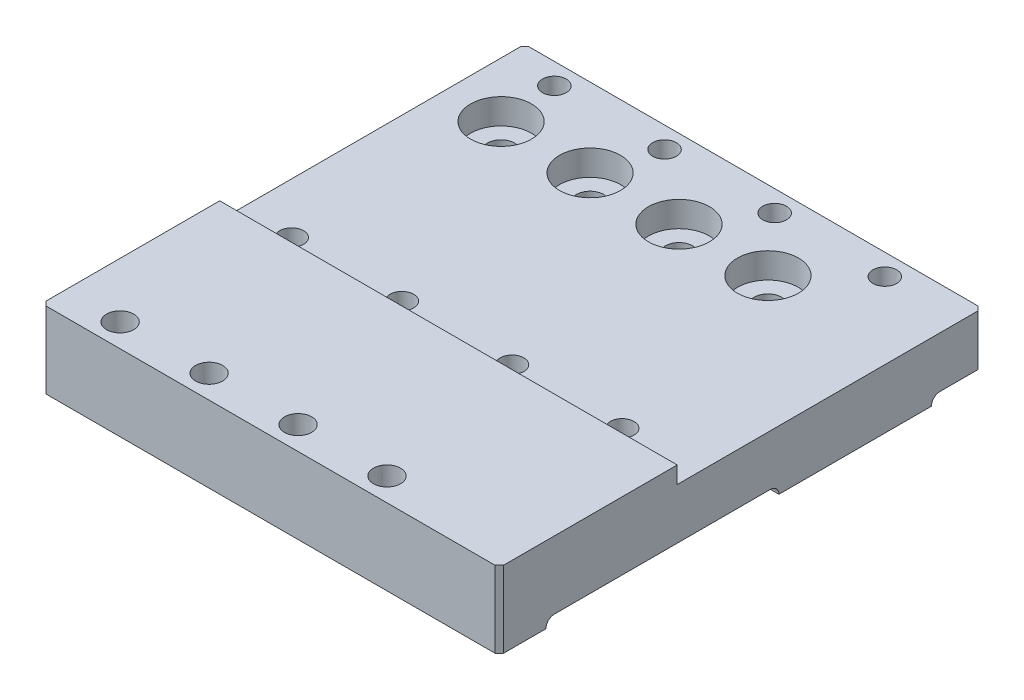
from build123d import *

# Parameters (mm, degrees)
SKETCH_1_W                     = 540
SKETCH_1_H                     = 570
EXTRUDE_1_DEPTH                = 90
CUT_EXTRUDE_1_REACH            = 619.191
SKETCH_2_W                     = 360
SKETCH_2_H                     = 20
SKETCH_2_W_2                   = 60
SKETCH_2_H_2                   = 10
SKETCH_2_W_3                   = 275
M30X2_0_1_D                    = 28
PATTERN_LINEAR_1_COUNT         = 4
PATTERN_LINEAR_1_PITCH         = 130
PATTERN_LINEAR_1_COUNT_DIR2    = 2
PATTERN_LINEAR_1_PITCH_DIR2    = 310
HOLE_WIZARD_M1_6_1_D           = 32
HOLE_WIZARD_M1_6_1_CBORE_D     = 72
HOLE_WIZARD_M1_6_1_CBORE_DEPTH = 30
PATTERN_LINEAR_2_COUNT         = 4
PATTERN_LINEAR_2_PITCH         = 105
HOLE_WIZARD_1_0_1_1_D          = 32
PATTERN_LINEAR_3_COUNT         = 4
PATTERN_LINEAR_3_PITCH         = 105
FILLET_1_R                     = 10
HOLE_WIZARD_M16_1_D            = 14
HOLE_WIZARD_M16_1_DEPTH        = 30
HOLE_WIZARD_M16_1_TIP          = 4.206024333
CHAMFER_1_SIZE                 = 5


with BuildPart() as part:
    # 草图1 → 凸台-拉伸1 (new body)
    with BuildSketch(Plane(origin=(0, 0, 0), x_dir=(1, 0, 0), z_dir=(0, 1, 0))):
        Rectangle(SKETCH_1_W, SKETCH_1_H)
    extrude(amount=-EXTRUDE_1_DEPTH)

    # 草图2 → 切除-拉伸1 (cut, up to next)
    with BuildSketch(Plane.ZY.offset(270), mode=Mode.PRIVATE) as cut_extrude_1_sk1:
        with Locations((-105, -10)):
            Rectangle(SKETCH_2_W, SKETCH_2_H)
    cut_extrude_1_tool1 = extrude(cut_extrude_1_sk1.sketch, amount=-CUT_EXTRUDE_1_REACH, mode=Mode.PRIVATE) & part.part
    # 草图2 → 切除-拉伸1 (cut, up to next)
    with BuildSketch(Plane.ZY.offset(270), mode=Mode.PRIVATE) as cut_extrude_1_sk2:
        with Locations((-255, -85)):
            Rectangle(SKETCH_2_W_2, SKETCH_2_H_2)
    cut_extrude_1_tool2 = extrude(cut_extrude_1_sk2.sketch, amount=-CUT_EXTRUDE_1_REACH, mode=Mode.PRIVATE) & part.part
    # 草图2 → 切除-拉伸1 (cut, up to next)
    with BuildSketch(Plane.ZY.offset(270), mode=Mode.PRIVATE) as cut_extrude_1_sk3:
        with Locations((92.5, -85)):
            Rectangle(SKETCH_2_W_3, SKETCH_2_H_2)
    cut_extrude_1_tool3 = extrude(cut_extrude_1_sk3.sketch, amount=-CUT_EXTRUDE_1_REACH, mode=Mode.PRIVATE) & part.part
    add(cut_extrude_1_tool1.solids().sort_by_distance((-270, -10, -105))[0], mode=Mode.SUBTRACT)
    add(cut_extrude_1_tool2.solids().sort_by_distance((-270, -85, -255))[0], mode=Mode.SUBTRACT)
    add(cut_extrude_1_tool3.solids().sort_by_distance((-270, -85, 92.5))[0], mode=Mode.SUBTRACT)

    # M30x2.0 螺纹孔1 (through all)
    with Locations(Plane(origin=(180, -20, 50), x_dir=(0, 0, 1), z_dir=(0, 1, 0))):
        with Locations((0, 0)):
            m30x2_0_1 = Hole(M30X2_0_1_D / 2)

    # 阵列(线性)1: M30x2.0 _1 4 × 2
    with Locations(*[(-i * PATTERN_LINEAR_1_PITCH, 0, -j * PATTERN_LINEAR_1_PITCH_DIR2) for i in range(PATTERN_LINEAR_1_COUNT) for j in range(PATTERN_LINEAR_1_COUNT_DIR2) if (i, j) != (0, 0)]):
        add(m30x2_0_1, mode=Mode.SUBTRACT)

    # M1.6 六角头螺栓的柱形沉头孔1 (through all)
    with Locations(Plane(origin=(-205, -20, -192.080967971), x_dir=(0, 0, 1), z_dir=(0, 1, 0))):
        with Locations((0, 0)):
            hole_wizard_m1_6_1 = CounterBoreHole(HOLE_WIZARD_M1_6_1_D / 2, HOLE_WIZARD_M1_6_1_CBORE_D / 2, HOLE_WIZARD_M1_6_1_CBORE_DEPTH)

    # 阵列(线性)2: M1.6 六角头螺栓的柱形沉头孔1 ×4
    with Locations(*[(i * PATTERN_LINEAR_2_PITCH, 0, 0) for i in range(1, PATTERN_LINEAR_2_COUNT)]):
        add(hole_wizard_m1_6_1, mode=Mode.SUBTRACT)

    # Ø1.0 (1) 直径孔1 (through all)
    with Locations(Plane(origin=(-205, 0, 257.5), x_dir=(0, 0, 1), z_dir=(0, 1, 0))):
        with Locations((0, 0)):
            hole_wizard_1_0_1_1 = Hole(HOLE_WIZARD_1_0_1_1_D / 2)

    # 阵列(线性)3: Ø1.0 (1) 直径孔1 ×4
    with Locations(*[(i * PATTERN_LINEAR_3_PITCH, 0, 0) for i in range(1, PATTERN_LINEAR_3_COUNT)]):
        add(hole_wizard_1_0_1_1, mode=Mode.SUBTRACT)

    # 圆角1
    fillet_1_edges = [part.edges().sort_by_distance(p)[0] for p in [
        (0, -80, -45),
        (0, -80, 230),
        (0, -80, -225),
    ]]
    fillet(fillet_1_edges, radius=FILLET_1_R - 0.0001)  # a hair under: the kernel refuses the full size

    # M16 螺纹孔1
    with Locations(Plane(origin=(-150, -48, -285), x_dir=(-1, 0, 0), z_dir=(0, 0, -1))):
        with Locations((0, 0), (-300, 0)):
            Hole(HOLE_WIZARD_M16_1_D / 2, depth=HOLE_WIZARD_M16_1_DEPTH)
            with Locations((0, 0, -(HOLE_WIZARD_M16_1_DEPTH + HOLE_WIZARD_M16_1_TIP / 2))):  # 118° drill point
                Cone(0, HOLE_WIZARD_M16_1_D / 2, HOLE_WIZARD_M16_1_TIP, mode=Mode.SUBTRACT)

    # 倒角1
    chamfer_1_edges = [part.edges().sort_by_distance(p)[0] for p in [
        (270, -50, -285),
        (-270, -50, -285),
        (270, -45, 285),
        (-270, -45, 285),
    ]]
    chamfer(chamfer_1_edges, length=CHAMFER_1_SIZE)


solid = part.part
